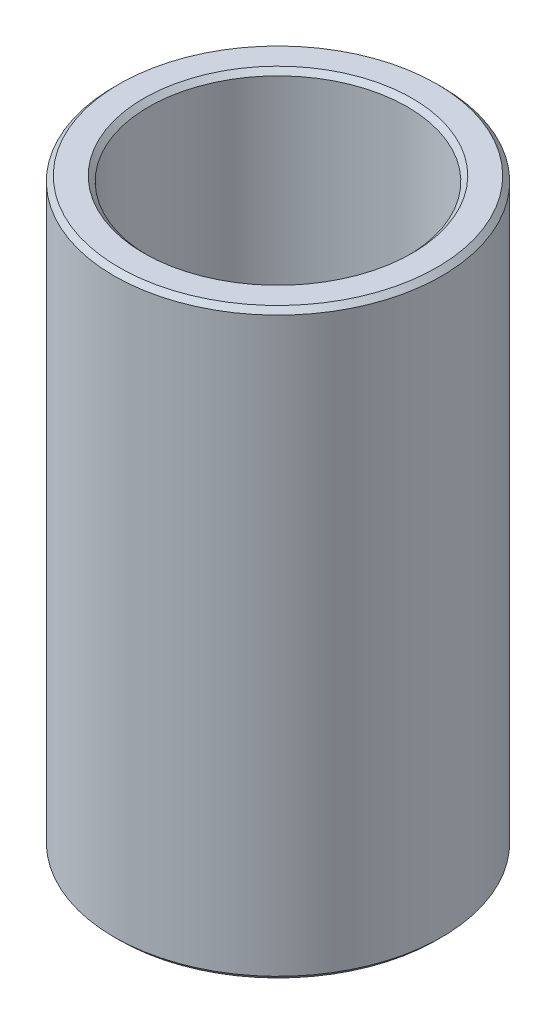
from build123d import *

# Parameters (mm, degrees)
SKETCH1_R           = 47.5
BOSS_EXTRUDE1_DEPTH = 168.876734196
SKETCH2_R           = 37.489492831
CUT_EXTRUDE1_DEPTH  = 182.746668065
CHAMFER1_SIZE       = 1.423148373


with BuildPart() as part:
    # Sketch1 → Boss-Extrude1 (new body)
    with BuildSketch(Plane(origin=(0, 0, 0), x_dir=(1, 0, 0), z_dir=(0, 1, 0))):
        Circle(SKETCH1_R)
    extrude(amount=BOSS_EXTRUDE1_DEPTH)

    # Sketch2 → Cut-Extrude1 (cut, through all)
    with BuildSketch(Plane(origin=(0, 0, 0), x_dir=(1, 0, 0), z_dir=(0, 1, 0))):
        Circle(SKETCH2_R)
    extrude(amount=CUT_EXTRUDE1_DEPTH, mode=Mode.SUBTRACT)

    # Chamfer1
    chamfer1_edges = [part.edges().sort_by_distance(p)[0] for p in [
        (-37.489492831, 168.876734196, 0),
        (-37.489492831, 0, 0),
        (-47.5, 0, 0),
        (-47.5, 168.876734196, 0),
    ]]
    chamfer(chamfer1_edges, length=CHAMFER1_SIZE)


solid = part.part
